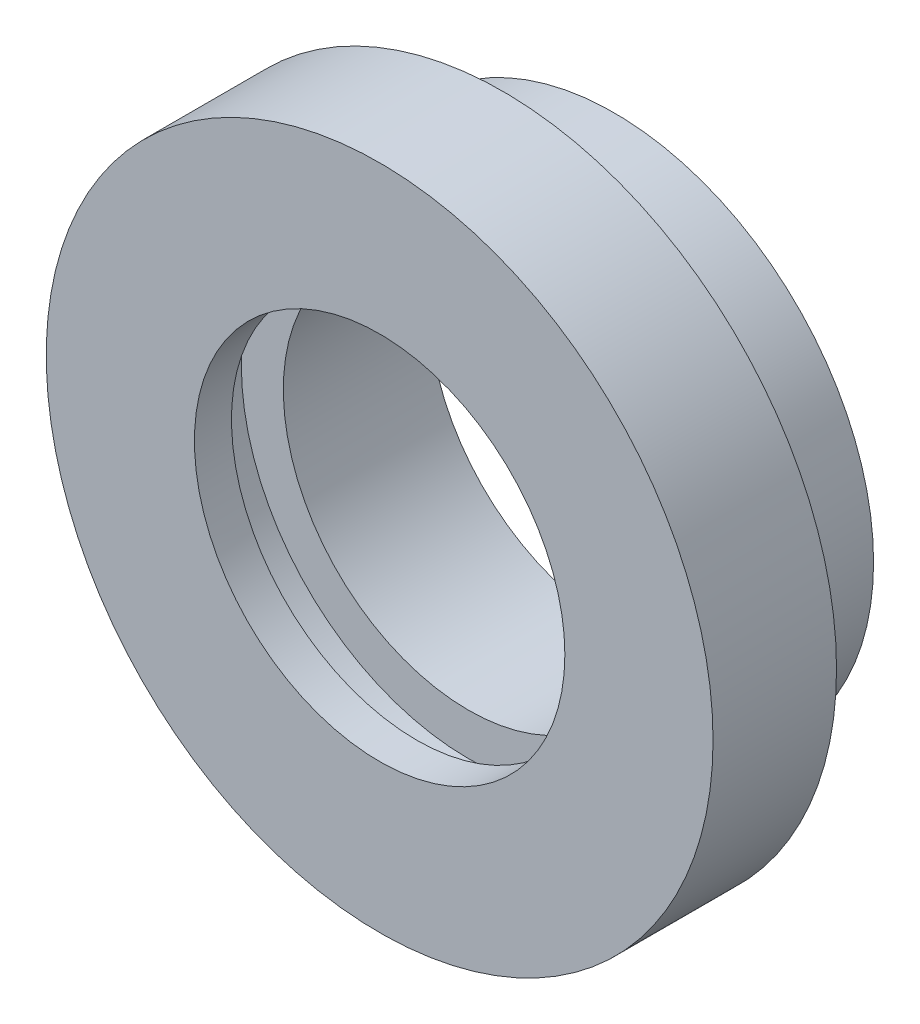
from build123d import *

# Parameters (mm, degrees)
STOCK_PPV4_2_START                       = -145
STOCK_PPV4_2_EXTRUDER_MB_1_OUTLINE_R     = 27
STOCK_PPV4_2_EXTRUDER_MB_1_OUTLINE_R_2   = 15
STOCK_PPV4_2_EXTRUDER_MB_1_DEPTH         = 10
STOCK_PPV4_2_START_2                     = -154
STOCK_PPV4_2_EXTRUDER_MB_1_2_OUTLINE_R   = 21
STOCK_PPV4_2_EXTRUDER_MB_1_2_OUTLINE_R_2 = 15
STOCK_PPV4_2_EXTRUDER_MB_1_2_DEPTH       = 9
SKETCH1_W                                = 4.2
SKETCH1_H                                = 3.4


# Read off the part's stored shape, not the designer's step: Stock-PPV4.2 - Extruder - MB-1
with BuildPart() as part:
    # Stock-PPV4.2 - Extruder - MB-1 outline → Stock-PPV4.2 - Extruder - MB-1 (new body)
    with BuildSketch(Plane.XY.offset(STOCK_PPV4_2_START)):
        Circle(STOCK_PPV4_2_EXTRUDER_MB_1_OUTLINE_R)
        Circle(STOCK_PPV4_2_EXTRUDER_MB_1_OUTLINE_R_2, mode=Mode.SUBTRACT)
    extrude(amount=STOCK_PPV4_2_EXTRUDER_MB_1_DEPTH)

    # Stock-PPV4.2 - Extruder - MB-1 2 outline → Stock-PPV4.2 - Extruder - MB-1 2 (add)
    with BuildSketch(Plane.XY.offset(STOCK_PPV4_2_START_2)):
        Circle(STOCK_PPV4_2_EXTRUDER_MB_1_2_OUTLINE_R)
        Circle(STOCK_PPV4_2_EXTRUDER_MB_1_2_OUTLINE_R_2, mode=Mode.SUBTRACT)
    extrude(amount=STOCK_PPV4_2_EXTRUDER_MB_1_2_DEPTH)

    # Sketch1 → Cut-Revolve1 (revolve, cut)
    with BuildSketch(Plane(origin=(0, 0, 0), x_dir=(0, 0, -1), z_dir=(1, 0, 0)), mode=Mode.PRIVATE) as cut_revolve1_sk:
        with Locations((140.1, 16.7)):
            Rectangle(SKETCH1_W, SKETCH1_H)
    revolve(cut_revolve1_sk.sketch.rotate(Axis((0, 0, 0), (0, 0, -1)), 90), axis=Axis((0, 0, 0), (0, 0, -1)), mode=Mode.SUBTRACT)


solid = part.part
